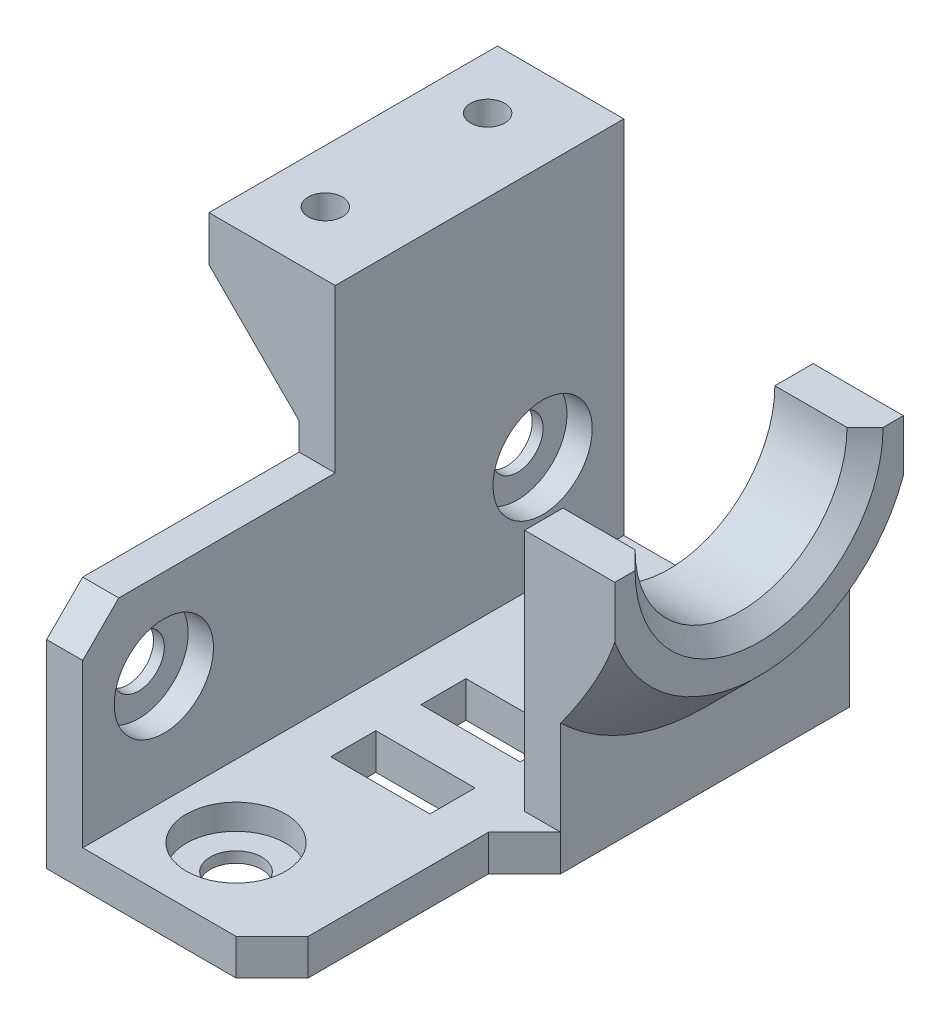
from build123d import *

# Parameters (mm, degrees)
BOSS_EXTRU_1_DEPTH          = 60
ENL_V_START                 = -4
ENL_V_MAT_EXTRU_1_OUTLINE_R = 2.85
ENL_V_MAT_EXTRU_1_DEPTH     = 4
ESQUISSE3_R                 = 5.5
ENL_V_MAT_EXTRU_2_DEPTH     = 2.8
ESQUISSE4_R                 = 2.85
ENL_V_MAT_EXTRU_3_DEPTH     = 20
ESQUISSE5_R                 = 5.5
ENL_V_MAT_EXTRU_4_DEPTH     = 2.8
ESQUISSE6_W                 = 4
ESQUISSE6_H                 = 32
BOSS_EXTRU_2_DEPTH          = 31
CHANFREIN1_SIZE             = 4
ESQUISSE7_R                 = 11.75
ENL_V_MAT_EXTRU_5_DEPTH     = 4
ESQUISSE9_W                 = 4
ESQUISSE9_H                 = 28
ENL_V_MAT_EXTRU_6_DEPTH     = 20
BOSS_EXTRU_4_DEPTH          = 32
ENL_V_MAT_EXTRU_7_REACH     = 82.975
ESQUISSE11_R                = 1.9
ENL_V_START_2               = -6
ESQUISSE12_R                = 3.75
ENL_V_MAT_EXTRU_8_DEPTH     = 20
CHANFREIN2_SIZE             = 4
ESQUISSE13_W                = 14
ESQUISSE13_H                = 32
ENL_V_MAT_EXTRU_9_DEPTH     = 2
BOSS_EXTRU_5_START          = 6
BOSS_EXTRU_5_DEPTH          = 6
CHANFREIN3_SIZE             = 7
CHANFREIN4_SIZE             = 2
ESQUISSE15_W                = 11
ESQUISSE15_H                = 5
ENL_V_MAT_EXTRU_10_DEPTH    = 10


# Read off the part's stored shape, not the designer's step: Enlèv. mat.-Extru.1
# Some blends are built 0.0001 mm under size
with BuildPart() as part:
    # Esquisse1 → Boss.-Extru.1 (new body)
    with BuildSketch(Plane.XY):
        Polygon((0, 0), (0, 46), (4, 46), (4, 4), (25, 4), (25, 0), align=None)
    extrude(amount=BOSS_EXTRU_1_DEPTH)

    # Enlèv. mat.-Extru.1 outline → Enlèv. mat.-Extru.1 (cut)
    with BuildSketch(Plane(origin=(0, 4, 0), x_dir=(1, 0, 0), z_dir=(0, 1, 0)).offset(ENL_V_START)):
        with Locations((12, -9)):
            Circle(ENL_V_MAT_EXTRU_1_OUTLINE_R)
        with Locations((12, -51)):
            Circle(ENL_V_MAT_EXTRU_1_OUTLINE_R)
    extrude(amount=ENL_V_MAT_EXTRU_1_DEPTH, mode=Mode.SUBTRACT)

    # Esquisse3 → Enlèv. mat.-Extru.2 (cut)
    with BuildSketch(Plane(origin=(0, 4, 0), x_dir=(1, 0, 0), z_dir=(0, 1, 0))):
        with Locations(Location((12, -9, 0), (0, 0, 180))):
            Circle(ESQUISSE3_R)
        with Locations(Location((12, -51, 0), (0, 0, 180))):
            Circle(ESQUISSE3_R)
    extrude(amount=-ENL_V_MAT_EXTRU_2_DEPTH, mode=Mode.SUBTRACT)

    # Esquisse4 → Enlèv. mat.-Extru.3 (cut)
    with BuildSketch(Plane(origin=(4, 0, 0), x_dir=(0, 0, -1), z_dir=(1, 0, 0))):
        with Locations(Location((-51, 16, 0), (0, 0, 90))):
            Circle(ESQUISSE4_R)
        with Locations(Location((-9, 16, 0), (0, 0, 90))):
            Circle(ESQUISSE4_R)
    extrude(amount=-ENL_V_MAT_EXTRU_3_DEPTH, mode=Mode.SUBTRACT)

    # Esquisse5 → Enlèv. mat.-Extru.4 (cut)
    with BuildSketch(Plane(origin=(4, 0, 0), x_dir=(0, 0, -1), z_dir=(1, 0, 0))):
        with Locations(Location((-51, 16, 0), (0, 0, 90))):
            Circle(ESQUISSE5_R)
        with Locations(Location((-9, 16, 0), (0, 0, 90))):
            Circle(ESQUISSE5_R)
    extrude(amount=-ENL_V_MAT_EXTRU_4_DEPTH, mode=Mode.SUBTRACT)

    # Esquisse6 → Boss.-Extru.2 (add)
    with BuildSketch(Plane.XZ):
        with Locations((27, 16)):
            Rectangle(ESQUISSE6_W, ESQUISSE6_H)
    extrude(amount=-BOSS_EXTRU_2_DEPTH)

    # Chanfrein1
    chanfrein1_edges = [part.edges().sort_by_distance(p)[0] for p in [
        (25, 2, 32),
    ]]
    chamfer(chanfrein1_edges, length=CHANFREIN1_SIZE - 0.0001)  # a hair under: the kernel refuses the full size

    # Esquisse7 → Enlèv. mat.-Extru.5 (cut)
    with BuildSketch(Plane(origin=(29, 0, 0), x_dir=(0, 0, -1), z_dir=(1, 0, 0))):
        with Locations((-16, 31)):
            Circle(ESQUISSE7_R)
    extrude(amount=-ENL_V_MAT_EXTRU_5_DEPTH, mode=Mode.SUBTRACT)

    # Esquisse9 → Enlèv. mat.-Extru.6 (cut)
    with BuildSketch(Plane(origin=(0, 46, 0), x_dir=(1, 0, 0), z_dir=(0, 1, 0))):
        with Locations((2, -46)):
            Rectangle(ESQUISSE9_W, ESQUISSE9_H)
    extrude(amount=-ENL_V_MAT_EXTRU_6_DEPTH, mode=Mode.SUBTRACT)

    # Esquisse10 → Boss.-Extru.4 (add)
    with BuildSketch(Plane.XY.offset(32)):
        Polygon((0, 29), (-10, 39), (-10, 46), (0, 46), (4, 46), (4, 26), (0, 26), align=None)
    extrude(amount=-BOSS_EXTRU_4_DEPTH)

    # Enlèv. mat.-Extru.7: up to this plane
    enl_v_mat_extru_7_end = Plane(origin=(0, 29, 0), z_dir=(-0.7071067811865436, -0.7071067811865517, 0))
    # Esquisse11 → Enlèv. mat.-Extru.7 (cut, up to the surface)
    with BuildSketch(Plane(origin=(0, 46, 0), x_dir=(1, 0, 0), z_dir=(0, 1, 0)), mode=Mode.PRIVATE) as enl_v_mat_extru_7_sk1:
        with Locations(Location((-4.1, -7, 0), (0, 0, 270))):
            Circle(ESQUISSE11_R)
    enl_v_mat_extru_7_tool1 = split(extrude(enl_v_mat_extru_7_sk1.sketch, amount=-ENL_V_MAT_EXTRU_7_REACH, mode=Mode.PRIVATE), bisect_by=enl_v_mat_extru_7_end, keep=Keep.BOTH, mode=Mode.PRIVATE)
    add(enl_v_mat_extru_7_tool1.solids().sort_by_distance((-4.1, 46, 7))[0], mode=Mode.SUBTRACT)
    # Esquisse11 → Enlèv. mat.-Extru.7 (cut, up to the surface)
    with BuildSketch(Plane(origin=(0, 46, 0), x_dir=(1, 0, 0), z_dir=(0, 1, 0)), mode=Mode.PRIVATE) as enl_v_mat_extru_7_sk2:
        with Locations(Location((-4.1, -25, 0), (0, 0, 270))):
            Circle(ESQUISSE11_R)
    enl_v_mat_extru_7_tool2 = split(extrude(enl_v_mat_extru_7_sk2.sketch, amount=-ENL_V_MAT_EXTRU_7_REACH, mode=Mode.PRIVATE), bisect_by=enl_v_mat_extru_7_end, keep=Keep.BOTH, mode=Mode.PRIVATE)
    add(enl_v_mat_extru_7_tool2.solids().sort_by_distance((-4.1, 46, 25))[0], mode=Mode.SUBTRACT)

    # Esquisse12 → Enlèv. mat.-Extru.8 (cut)
    with BuildSketch(Plane(origin=(0, 46, 0), x_dir=(1, 0, 0), z_dir=(0, 1, 0)).offset(ENL_V_START_2)):
        with Locations(Location((-4.1, -7, 0), (0, 0, 270))):
            Circle(ESQUISSE12_R)
        with Locations(Location((-4.1, -25, 0), (0, 0, 270))):
            Circle(ESQUISSE12_R)
    extrude(amount=-ENL_V_MAT_EXTRU_8_DEPTH, mode=Mode.SUBTRACT)

    # Chanfrein2
    chanfrein2_edges = [part.edges().sort_by_distance(p)[0] for p in [
        (2, 26, 60),
        (25, 2, 60),
    ]]
    chamfer(chanfrein2_edges, length=CHANFREIN2_SIZE)

    # Esquisse13 → Enlèv. mat.-Extru.9 (cut)
    with BuildSketch(Plane(origin=(0, 46, 0), x_dir=(1, 0, 0), z_dir=(0, 1, 0))):
        with Locations((-3, -16)):
            Rectangle(ESQUISSE13_W, ESQUISSE13_H)
    extrude(amount=-ENL_V_MAT_EXTRU_9_DEPTH, mode=Mode.SUBTRACT)

    # Esquisse14 → Boss.-Extru.5 (add)
    with BuildSketch(Plane(origin=(29, 0, 0), x_dir=(0, 0, -1), z_dir=(1, 0, 0)).offset(BOSS_EXTRU_5_START)):
        with BuildLine():
            Line((-32, 31), (-27.75, 31))
            ThreePointArc((-27.75, 31), (-16, 19.25), (-4.25, 31))
            Line((-4.25, 31), (0, 31))
            ThreePointArc((0, 31), (-16, 15), (-32, 31))
        make_face()
    extrude(amount=-BOSS_EXTRU_5_DEPTH)

    # Chanfrein3
    # the kernel refuses this chamfer: 7 mm, written as the material it adds along each edge
    with BuildSketch(Plane(origin=(29, 31, 16), x_dir=(0, 0, -1), z_dir=(0, 1, 0))) as chanfrein3_piece_1_section:
        Polygon((16 + CHANFREIN3_SIZE, 0), (16, -CHANFREIN3_SIZE), (16, 0), align=None)
    chanfrein3_piece_1 = revolve(axis=Axis((29, 31, 16), (-1, 0, 0)), revolution_arc=180, mode=Mode.PRIVATE)
    chanfrein3_piece_1 = split(chanfrein3_piece_1, bisect_by=Plane(origin=(32, 14.901456645, 32), z_dir=(0, 0, -1)), keep=Keep.TOP, mode=Mode.PRIVATE)
    chanfrein3_piece_1 = split(chanfrein3_piece_1, bisect_by=Plane(origin=(32, 14.901456645, 0), z_dir=(0, 0, 1)), keep=Keep.TOP, mode=Mode.PRIVATE)
    chanfrein3_piece_1 = split(chanfrein3_piece_1, bisect_by=Plane(origin=(35, 14.901456645, 16), z_dir=(-1, 0, 0)), keep=Keep.TOP, mode=Mode.PRIVATE)
    add(chanfrein3_piece_1)

    # Chanfrein4
    chanfrein4_edges = [part.edges().sort_by_distance(p)[0] for p in [
        (35, 19.25, 16),
    ]]
    chamfer(chanfrein4_edges, length=CHANFREIN4_SIZE)

    # Esquisse15 → Enlèv. mat.-Extru.10 (cut)
    with BuildSketch(Plane(origin=(0, 4, 0), x_dir=(1, 0, 0), z_dir=(0, 1, 0))):
        with Locations((14.5, -25)):
            Rectangle(ESQUISSE15_W, ESQUISSE15_H)
        with Locations((14.5, -35)):
            Rectangle(ESQUISSE15_W, ESQUISSE15_H)
    extrude(amount=-ENL_V_MAT_EXTRU_10_DEPTH, mode=Mode.SUBTRACT)


solid = part.part
